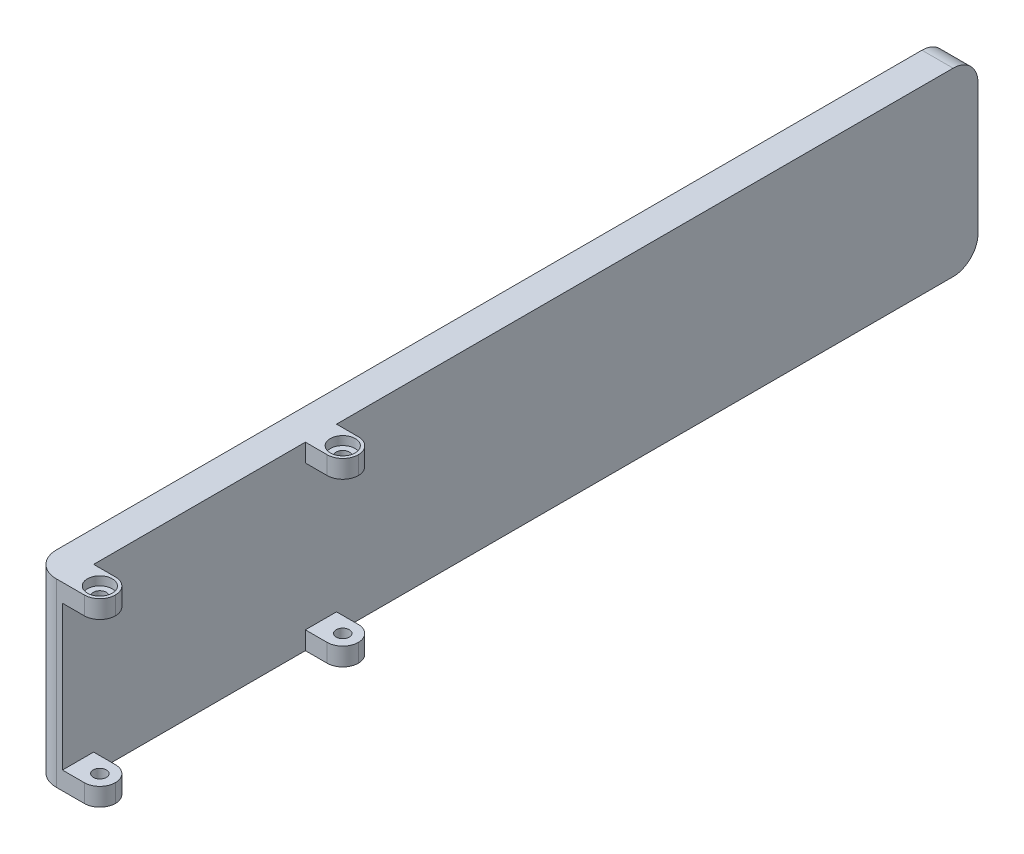
from build123d import *

# Parameters (mm, degrees)
SKETCH1_W           = 5
SKETCH1_H           = 147
BOSS_EXTRUDE1_DEPTH = 29
SKETCH2_W           = 5
SKETCH2_H           = 2.9
BOSS_EXTRUDE2_DEPTH = 6
SKETCH3_R           = 1.05
CUT_EXTRUDE1_DEPTH  = 150.953326072
SKETCH4_R           = 2
CUT_EXTRUDE2_DEPTH  = 1.4
FILLET1_R           = 4
FILLET2_R           = 2.5


with BuildPart() as part:
    # Sketch1 → Boss-Extrude1 (new body)
    with BuildSketch(Plane(origin=(0, 0, 0), x_dir=(1, 0, 0), z_dir=(0, 1, 0))):
        with Locations((-2.5, 73.5)):
            Rectangle(SKETCH1_W, SKETCH1_H)
    extrude(amount=BOSS_EXTRUDE1_DEPTH)

    # Sketch2 → Boss-Extrude2 (add)
    with BuildSketch(Plane(origin=(0, 0, 0), x_dir=(0, 0, -1), z_dir=(1, 0, 0))):
        with Locations((2.5, 27.55)):
            Rectangle(SKETCH2_W, SKETCH2_H)
        with Locations((41.5, 27.55)):
            Rectangle(SKETCH2_W, SKETCH2_H)
        with Locations((41.5, 1.45)):
            Rectangle(SKETCH2_W, SKETCH2_H)
        with Locations((2.5, 1.45)):
            Rectangle(SKETCH2_W, SKETCH2_H)
    extrude(amount=BOSS_EXTRUDE2_DEPTH)

    # Sketch3 → Cut-Extrude1 (cut, through all)
    with BuildSketch(Plane(origin=(0, 29, 0), x_dir=(1, 0, 0), z_dir=(0, 1, 0))):
        with Locations(Location((3.5, 41.5, 0), (0, 0, 270))):
            Circle(SKETCH3_R)
        with Locations(Location((3.5, 2.5, 0), (0, 0, 270))):
            Circle(SKETCH3_R)
    extrude(amount=-CUT_EXTRUDE1_DEPTH, mode=Mode.SUBTRACT)

    # Sketch4 → Cut-Extrude2 (cut)
    with BuildSketch(Plane(origin=(0, 29, 0), x_dir=(1, 0, 0), z_dir=(0, 1, 0))):
        with Locations(Location((3.5, 41.5, 0), (0, 0, 270))):
            Circle(SKETCH4_R)
        with Locations(Location((3.5, 2.5, 0), (0, 0, 270))):
            Circle(SKETCH4_R)
    cut_extrude2 = extrude(amount=-CUT_EXTRUDE2_DEPTH, mode=Mode.SUBTRACT)

    # Mirror2: Cut-Extrude2 across plane
    add(cut_extrude2.mirror(Plane.ZX.offset(14.5)), mode=Mode.SUBTRACT)

    # Fillet1
    fillet1_edges = [part.edges().sort_by_distance(p)[0] for p in [
        (-2.5, 0, -147),
        (-5, 14.5, 0),
        (-2.5, 29, -147),
    ]]
    fillet(fillet1_edges, radius=FILLET1_R)

    # Fillet2
    fillet2_edges = [part.edges().sort_by_distance(p)[0] for p in [
        (6, 1.45, -5),
        (6, 1.45, 0),
        (6, 1.45, -44),
        (6, 1.45, -39),
        (6, 27.55, -44),
        (6, 27.55, -39),
        (6, 27.55, -5),
        (6, 27.55, 0),
    ]]
    fillet(fillet2_edges, radius=FILLET2_R - 0.0001)  # a hair under: the kernel refuses the full size


solid = part.part
